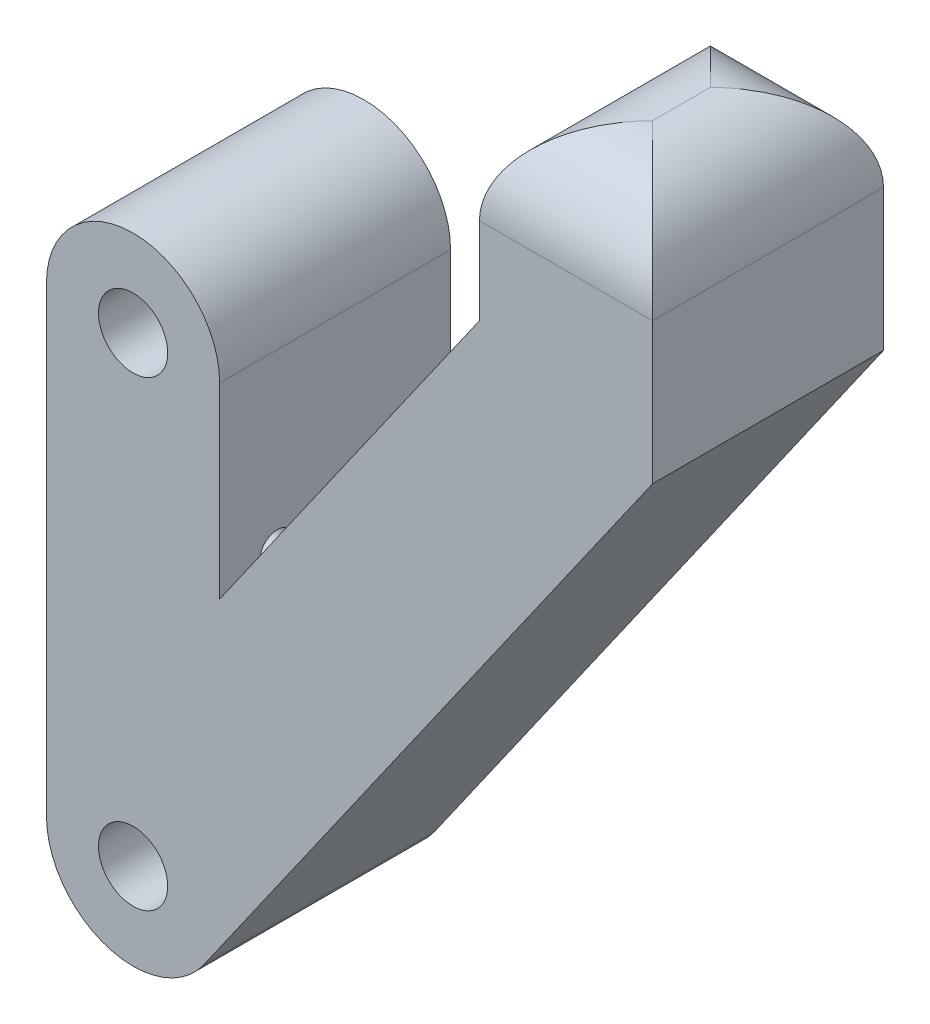
from build123d import *

# Parameters (mm, degrees)
SKETCH1_R           = 1.5
BOSS_EXTRUDE1_DEPTH = 10
FILLET1_R           = 3.75
SKETCH2_R           = 0.75
CUT_EXTRUDE1_DEPTH  = 7.5


with BuildPart() as part:
    # Sketch1 → Boss-Extrude1 (new body)
    with BuildSketch(Plane.XY):
        with BuildLine():
            Line((-3.75, 0), (-3.75, 20))
            ThreePointArc((-3.75, 20), (0, 23.75), (3.75, 20))
            Line((3.75, 20), (3.75, 11.893480509))
            Line((3.75, 11.893480509), (15, 27.960145585))
            Line((15, 27.960145585), (15, 35.460145585))
            Line((15, 35.460145585), (22.5, 35.460145585))
            Line((22.5, 35.460145585), (22.5, 25.595404668))
            Line((22.5, 25.595404668), (21.143640332, 23.658322312))
            Line((21.143640332, 23.658322312), (9.893640332, 7.591657236))
            Line((9.893640332, 7.591657236), (3.071820166, -2.150911636))
            ThreePointArc((3.071820166, -2.150911636), (-1.127646748, -3.576438565), (-3.75, 0))
        make_face()
        Circle(SKETCH1_R, mode=Mode.SUBTRACT)
        with Locations((0, 20)):
            Circle(SKETCH1_R, mode=Mode.SUBTRACT)
    extrude(amount=BOSS_EXTRUDE1_DEPTH)

    # Fillet1
    fillet1_edges = [part.edges().sort_by_distance(p)[0] for p in [
        (18.75, 35.460145585, 0),
        (22.5, 35.460145585, 5),
        (15, 35.460145585, 5),
        (18.75, 35.460145585, 10),
    ]]
    fillet(fillet1_edges, radius=FILLET1_R - 0.0001)  # a hair under: the kernel refuses the full size

    # Sketch2 → Cut-Extrude1 (cut)
    with BuildSketch(Plane.ZY.offset(3.75)):
        with Locations((7.5, 12.5)):
            Circle(SKETCH2_R)
        with Locations(Location((7.5, 7.5, 0), (0, 0, 180))):
            Circle(SKETCH2_R)
        with Locations((2.5, 7.5)):
            Circle(SKETCH2_R)
        with Locations(Location((2.5, 12.5, 0), (0, 0, 306.031603779))):
            Circle(SKETCH2_R)
    extrude(amount=-CUT_EXTRUDE1_DEPTH, mode=Mode.SUBTRACT)


solid = part.part
